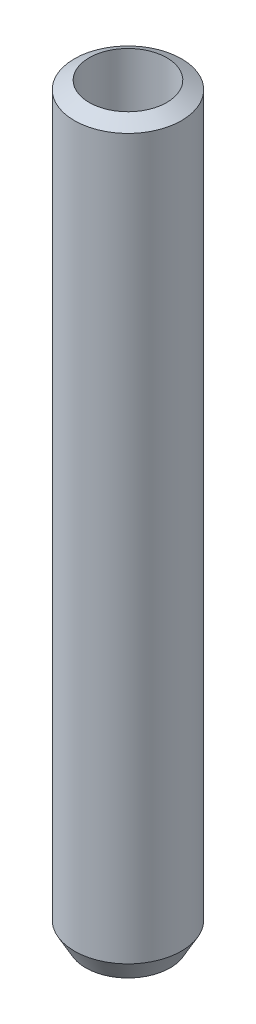
from build123d import *

# Parameters (mm, degrees)
SKETCH1_R           = 25
BOSS_EXTRUDE1_DEPTH = 350.316945
SKETCH2_R           = 18.104121469
CUT_EXTRUDE1_DEPTH  = 353.096523633
CHAMFER1_SIZE       = 5.296328
CHAMFER1_SIZE_2     = 9.454538


with BuildPart() as part:
    # Sketch1 → Boss-Extrude1 (new body)
    with BuildSketch(Plane(origin=(0, 0, 0), x_dir=(1, 0, 0), z_dir=(0, 1, 0))):
        with Locations(Location((0, 0, 0), (0, 0, 270))):
            Circle(SKETCH1_R)
    extrude(amount=BOSS_EXTRUDE1_DEPTH)

    # Sketch2 → Cut-Extrude1 (cut, through all)
    with BuildSketch(Plane(origin=(0, 0, 0), x_dir=(1, 0, 0), z_dir=(0, 1, 0))):
        with Locations(Location((0, 0, 0), (0, 0, 270))):
            Circle(SKETCH2_R)
    extrude(amount=CUT_EXTRUDE1_DEPTH, mode=Mode.SUBTRACT)

    # Chamfer1
    # the kernel refuses this chamfer: 9.454538, 5.296328 mm, written as the material it takes off along each edge
    with BuildSketch(Plane(origin=(0, 350.316945, 0), x_dir=(0, 0, 1), z_dir=(-1, 0, 0))) as chamfer1_piece_1:
        Polygon((25, -CHAMFER1_SIZE), (25 - CHAMFER1_SIZE_2, 0), (25, 0), align=None)
    revolve(axis=Axis((0, 350.316945, 0), (0, 1, 0)), mode=Mode.SUBTRACT)
    with BuildSketch(Plane(origin=(0, 0, 0), x_dir=(0, 0, 1), z_dir=(-1, 0, 0))) as chamfer1_piece_2:
        Polygon((25, CHAMFER1_SIZE_2), (25 - CHAMFER1_SIZE, 0), (25, 0), align=None)
    revolve(axis=Axis((0, 0, 0), (0, 1, 0)), mode=Mode.SUBTRACT)


solid = part.part
